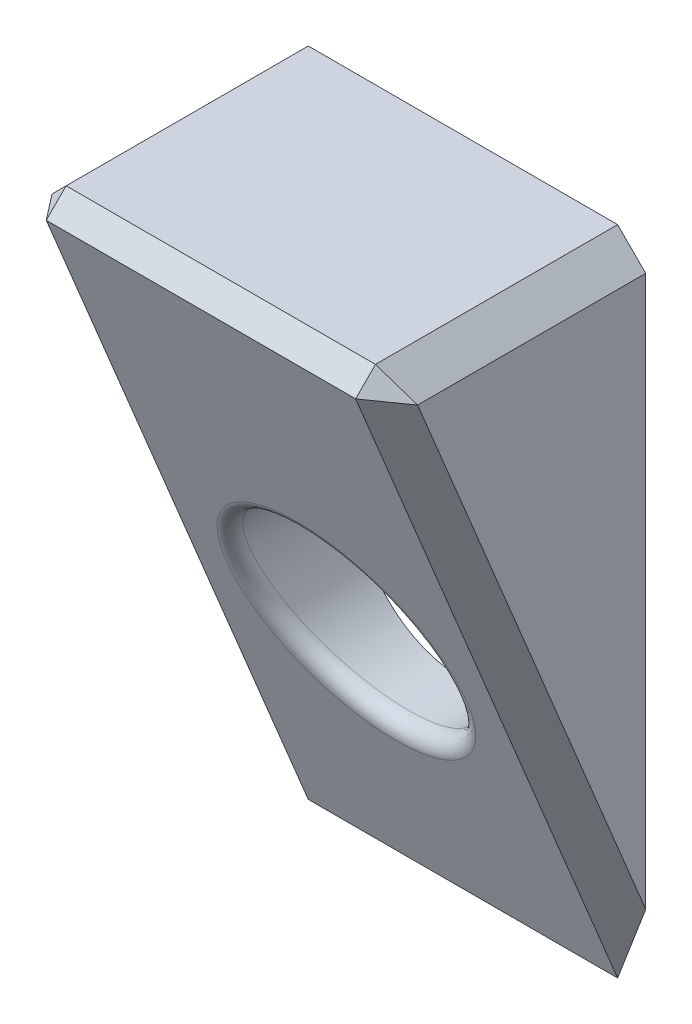
from build123d import *

# Parameters (mm, degrees)
RESSALTO_EXTRUS_O1_DEPTH = 13
ESBO_O3_R                = 3.75
CORTE_EXTRUS_O1_DEPTH    = 15
FILETE1_R                = 0.5


with BuildPart() as part:
    # Esboço2 → Ressalto-extrusão1 (new body)
    with BuildSketch(Plane(origin=(0, 0, 0), x_dir=(0, 0, -1), z_dir=(1, 0, 0))):
        Polygon((0, 5.167385512), (0, -18.032614488), (-9.609754647, 5.167385512), align=None)
    extrude(amount=RESSALTO_EXTRUS_O1_DEPTH)

    # Esboço3 → Corte-extrusão1 (cut)
    with BuildSketch(Plane(origin=(0, 0, 0), x_dir=(-1, 0, 0), z_dir=(0, 0, -1))):
        with Locations((-6.5, -7.832614488)):
            Circle(ESBO_O3_R)
    extrude(amount=-CORTE_EXTRUS_O1_DEPTH, mode=Mode.SUBTRACT)

    # Chanfro1
    # the kernel refuses this chamfer: 1, 0.765366865 mm, written as the material it takes off along each edge
    with BuildSketch(Plane(origin=(12.333333333, 4.598349918, 8.679921653), x_dir=(0.6671683756339832, -0.6671683756339838, -0.3313196600080107), z_dir=(0.7268306825413349, 0.4856527354584224, 0.485652735458423))) as chanfro1_piece_1:
        Polygon((-0.578784303, 0.323797402), (0.920087701, 0.323797402), (-0.341303398, -0.647594805), align=None)
    extrude(amount=1.33373176, mode=Mode.SUBTRACT)
    with BuildSketch(Plane(origin=(0.666666667, 4.598349918, 8.679921653), x_dir=(-0.6671683756339831, -0.6671683756339838, -0.3313196600080107), z_dir=(-0.7268306825413349, 0.48565273545842236, 0.485652735458423))) as chanfro1_piece_2:
        Polygon((-0.578784303, -0.323797402), (0.920087701, -0.323797402), (-0.341303398, 0.647594805), align=None)
    extrude(amount=1.33373176, mode=Mode.SUBTRACT)
    with BuildSketch(Plane(origin=(13, 5.167385512, 12.181437635), x_dir=(-0.9996219169112968, 0.02749587661058651, 0), z_dir=(0, 0, -1))) as chanfro1_piece_3:
        with BuildLine():
            Line((1.028673195, 0), (-0.056547155, -1.027117794))
            Line((-0.056547155, -1.027117794), (-0.076539593, -1.026567876))
            ThreePointArc((-0.076539593, -1.026567876), (-0.034129227, -0.51339783), (-0.019992438, 0.000549918))
            Line((-0.019992438, 0.000549918), (0.000549918, 0.019992438))
            ThreePointArc((0.000549918, 0.019992438), (0.514497665, 0.00585565), (1.029223113, 0.019992438))
            Line((1.029223113, 0.019992438), (1.028673195, 0))
        make_face()
    extrude(amount=14.753120623, mode=Mode.SUBTRACT)
    with BuildSketch(Plane(origin=(0, 5.167385512, 12.181437635), x_dir=(0.9996219169112968, 0.027495876610586494, 0), z_dir=(0, 0, -1))) as chanfro1_piece_4:
        with BuildLine():
            Line((1.028673195, 0), (-0.056547155, 1.027117794))
            Line((-0.056547155, 1.027117794), (-0.076539593, 1.026567876))
            ThreePointArc((-0.076539593, 1.026567876), (-0.034129227, 0.51339783), (-0.019992438, -0.000549918))
            Line((-0.019992438, -0.000549918), (0.000549918, -0.019992438))
            ThreePointArc((0.000549918, -0.019992438), (0.514497665, -0.00585565), (1.029223113, -0.019992438))
            Line((1.029223113, -0.019992438), (1.028673195, 0))
        make_face()
    extrude(amount=14.753120623, mode=Mode.SUBTRACT)
    with BuildSketch(Plane(origin=(0, -20.408539765, -0.984140473), x_dir=(-0.027495876610586358, 0.3825387462309866, -0.9235302292840447), z_dir=(0, 0.9238795325112864, 0.3826834323650908))) as chanfro1_piece_5:
        with BuildLine():
            Line((1.028673195, 0), (-0.056547155, -1.027117794))
            Line((-0.056547155, -1.027117794), (-0.076539593, -1.026567876))
            ThreePointArc((-0.076539593, -1.026567876), (-0.034129227, -0.51339783), (-0.019992438, 0.000549918))
            Line((-0.019992438, 0.000549918), (0.000549918, 0.019992438))
            ThreePointArc((0.000549918, 0.019992438), (0.514497665, 0.00585565), (1.029223113, 0.019992438))
            Line((1.029223113, 0.019992438), (1.028673195, 0))
        make_face()
    extrude(amount=30.254865023, mode=Mode.SUBTRACT)
    with BuildSketch(Plane(origin=(13, -20.408539765, -0.984140473), x_dir=(0.027495876610585605, 0.38253874623098666, -0.9235302292840448), z_dir=(0, 0.9238795325112864, 0.3826834323650908))) as chanfro1_piece_6:
        with BuildLine():
            Line((1.028673195, 0), (-0.056547155, 1.027117794))
            Line((-0.056547155, 1.027117794), (-0.076539593, 1.026567876))
            ThreePointArc((-0.076539593, 1.026567876), (-0.034129227, 0.51339783), (-0.019992438, -0.000549918))
            Line((-0.019992438, -0.000549918), (0.000549918, -0.019992438))
            ThreePointArc((0.000549918, -0.019992438), (0.514497665, -0.00585565), (1.029223113, -0.019992438))
            Line((1.029223113, -0.019992438), (1.028673195, 0))
        make_face()
    extrude(amount=30.254865023, mode=Mode.SUBTRACT)
    with BuildSketch(Plane(origin=(-2.571682988, 5.167385512, 9.609754647), x_dir=(0, 0.02749587661058651, -0.9996219169112968), z_dir=(1, 0, 0))) as chanfro1_piece_7:
        with BuildLine():
            Line((1.028673195, 0), (0.244288682, -0.742388668))
            Line((0.244288682, -0.742388668), (0.225607633, -0.749531386))
            ThreePointArc((0.225607633, -0.749531386), (0.120722331, -0.371738041), (-0.018681049, -0.007142717))
            Line((-0.018681049, -0.007142717), (0.000549918, 0.019992438))
            ThreePointArc((0.000549918, 0.019992438), (0.514497665, 0.00585565), (1.029223113, 0.019992438))
            Line((1.029223113, 0.019992438), (1.028673195, 0))
        make_face()
    extrude(amount=18.143365976, mode=Mode.SUBTRACT)

    # Filete1
    filete1_edges = [part.edges().sort_by_distance(p)[0] for p in [
        (10.25, -7.832628458, 4.22497255),
    ]]
    fillet(filete1_edges, radius=FILETE1_R)


solid = part.part
